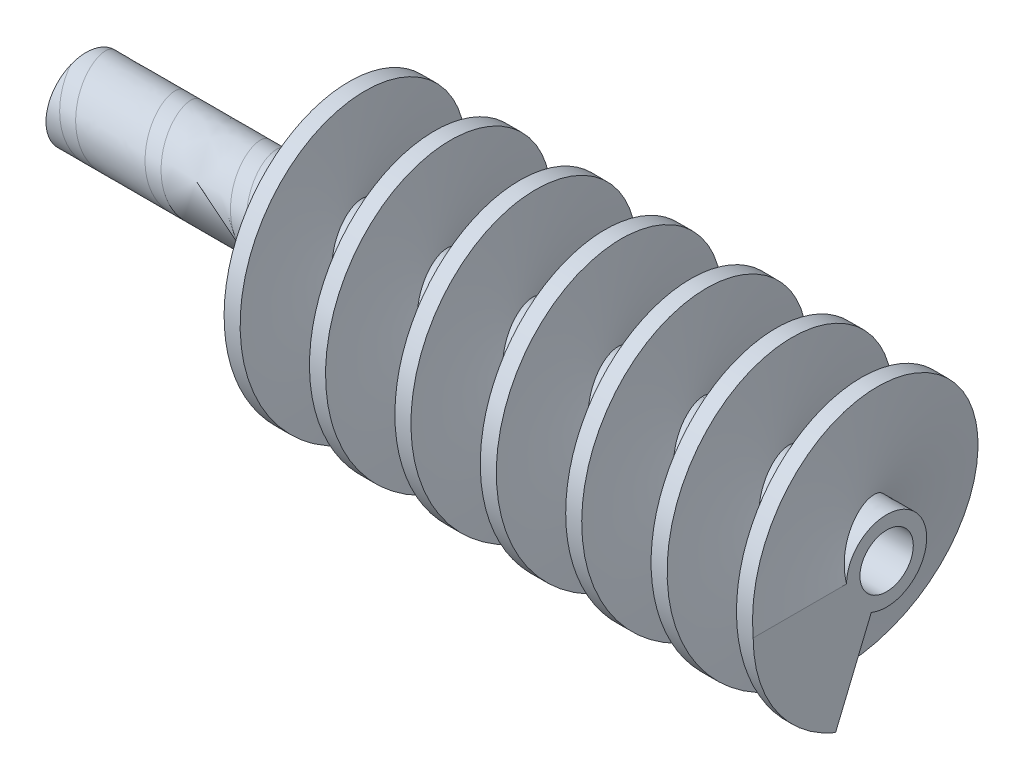
from build123d import *

# Parameters (mm, degrees)
CROQUIS1_R              = 25
SALIENTE_EXTRUIR1_DEPTH = 150
CORTAR_BARRER1_PITCH    = 16
CROQUIS5_R              = 5
CORTAR_EXTRUIR1_DEPTH   = 10
CROQUIS6_R              = 49.600049516
CROQUIS6_R_2            = 7.5
CORTAR_EXTRUIR2_DEPTH   = 44


with BuildPart() as part:
    # Croquis1 → Saliente-Extruir1 (new body)
    with BuildSketch(Plane(origin=(0, 0, 0), x_dir=(0, 0, -1), z_dir=(1, 0, 0))):
        Circle(CROQUIS1_R)
    extrude(amount=SALIENTE_EXTRUIR1_DEPTH)

    # Cortar-Barrer1: arcs per turn and ends read off the stored shape
    # Cortar-Barrer1: the profile of Croquis3 profile screwed along a right-hand helix through 15.5 turns, 18 arcs to a turn; built about Z, then put on its axis
    cortar_barrer1_z = Axis((0, 0, 0), (0, 0, 1))
    cortar_barrer1_corners = [(25.0003, -1.7454e-05, -14.000001778), (25.0003, -1.7454e-05, -27.000001778), (7.5, -5.236e-06, -27.000001778), (7.5, -5.236e-06, -14.000001778)]
    with BuildLine(mode=Mode.PRIVATE) as cortar_barrer1_profile:
        Line(cortar_barrer1_corners[0], cortar_barrer1_corners[1])
        Line(cortar_barrer1_corners[1], cortar_barrer1_corners[2])
        Line(cortar_barrer1_corners[2], cortar_barrer1_corners[3])
        Line(cortar_barrer1_corners[3], cortar_barrer1_corners[0])
    cortar_barrer1_cap = Face(cortar_barrer1_profile.wire())
    cortar_barrer1_turn_angles = [0, 10, 20, 30, 40, 50, 60, 70, 80, 90, 100, 110, 120, 130, 140, 150, 160, 170, 180, 190, 200, 210, 220, 230, 240, 250, 260, 270, 280, 290, 300, 310, 320, 330, 340, 350, 360]
    cortar_barrer1_turn_weights = [1, 0.984807753012208, 1, 0.984807753012208, 1, 0.984807753012208, 1, 0.984807753012208, 1, 0.984807753012208, 1, 0.984807753012208, 1, 0.984807753012208, 1, 0.984807753012208, 1, 0.984807753012208, 1, 0.984807753012208, 1, 0.984807753012208, 1, 0.984807753012208, 1, 0.984807753012208, 1, 0.984807753012208, 1, 0.984807753012208, 1, 0.984807753012208, 1, 0.984807753012208, 1, 0.984807753012208, 1]
    cortar_barrer1_turn_rails = [Edge.make_bspline([Vector(p[0], p[1], 0).rotate(cortar_barrer1_z, cortar_barrer1_turn_angles[k]) / cortar_barrer1_turn_weights[k] + Vector(0, 0, p[2] + CORTAR_BARRER1_PITCH * cortar_barrer1_turn_angles[k] / 360) for k in range(37)], [0, 0, 0, 1, 1, 2, 2, 3, 3, 4, 4, 5, 5, 6, 6, 7, 7, 8, 8, 9, 9, 10, 10, 11, 11, 12, 12, 13, 13, 14, 14, 15, 15, 16, 16, 17, 17, 18, 18, 18], 2, cortar_barrer1_turn_weights) for p in cortar_barrer1_corners]
    cortar_barrer1_turn_sides = [Face.make_surface_from_curves(cortar_barrer1_turn_rails[p[0]], cortar_barrer1_turn_rails[p[1]]) for p in [(0, 1), (1, 2), (2, 3), (3, 0)]]
    cortar_barrer1_last_angles = [5400, 5410, 5420, 5430, 5440, 5450, 5460, 5470, 5480, 5490, 5500, 5510, 5520, 5530, 5540, 5550, 5560, 5570, 5580]
    cortar_barrer1_last_weights = [1, 0.984807753012208, 1, 0.984807753012208, 1, 0.984807753012208, 1, 0.984807753012208, 1, 0.984807753012208, 1, 0.984807753012208, 1, 0.984807753012208, 1, 0.984807753012208, 1, 0.9848077530120992, 1]
    cortar_barrer1_last_rails = [Edge.make_bspline([Vector(p[0], p[1], 0).rotate(cortar_barrer1_z, cortar_barrer1_last_angles[k]) / cortar_barrer1_last_weights[k] + Vector(0, 0, p[2] + CORTAR_BARRER1_PITCH * cortar_barrer1_last_angles[k] / 360) for k in range(19)], [0, 0, 0, 1, 1, 2, 2, 3, 3, 4, 4, 5, 5, 6, 6, 7, 7, 8, 8, 9, 9, 9], 2, cortar_barrer1_last_weights) for p in cortar_barrer1_corners]
    cortar_barrer1_last_sides = [Face.make_surface_from_curves(cortar_barrer1_last_rails[p[0]], cortar_barrer1_last_rails[p[1]]) for p in [(0, 1), (1, 2), (2, 3), (3, 0)]]
    cortar_barrer1 = Plane(origin=(150, 0, 0), x_dir=(0, 0.7071067811865438, 0.7071067811865512), z_dir=(-1, 0, 0)) * Solid(Shell([*[p.moved(Location((0, 0, CORTAR_BARRER1_PITCH * i))) for i in range(15) for p in cortar_barrer1_turn_sides], *cortar_barrer1_last_sides, cortar_barrer1_cap, cortar_barrer1_cap.rotate(cortar_barrer1_z, 5580).moved(Location((0, 0, CORTAR_BARRER1_PITCH * 5580 / 360)))]))
    add(cortar_barrer1, mode=Mode.SUBTRACT)

    # Croquis5 → Cortar-Extruir1 (cut)
    with BuildSketch(Plane(origin=(150, 0, 0), x_dir=(0, 0, -1), z_dir=(1, 0, 0))):
        Circle(CROQUIS5_R)
    extrude(amount=-CORTAR_EXTRUIR1_DEPTH, mode=Mode.SUBTRACT)

    # Croquis6 → Cortar-Extruir2 (cut)
    with BuildSketch(Plane.ZY):
        Circle(CROQUIS6_R)
        Circle(CROQUIS6_R_2, mode=Mode.SUBTRACT)
    extrude(amount=-CORTAR_EXTRUIR2_DEPTH, mode=Mode.SUBTRACT)


solid = part.part
